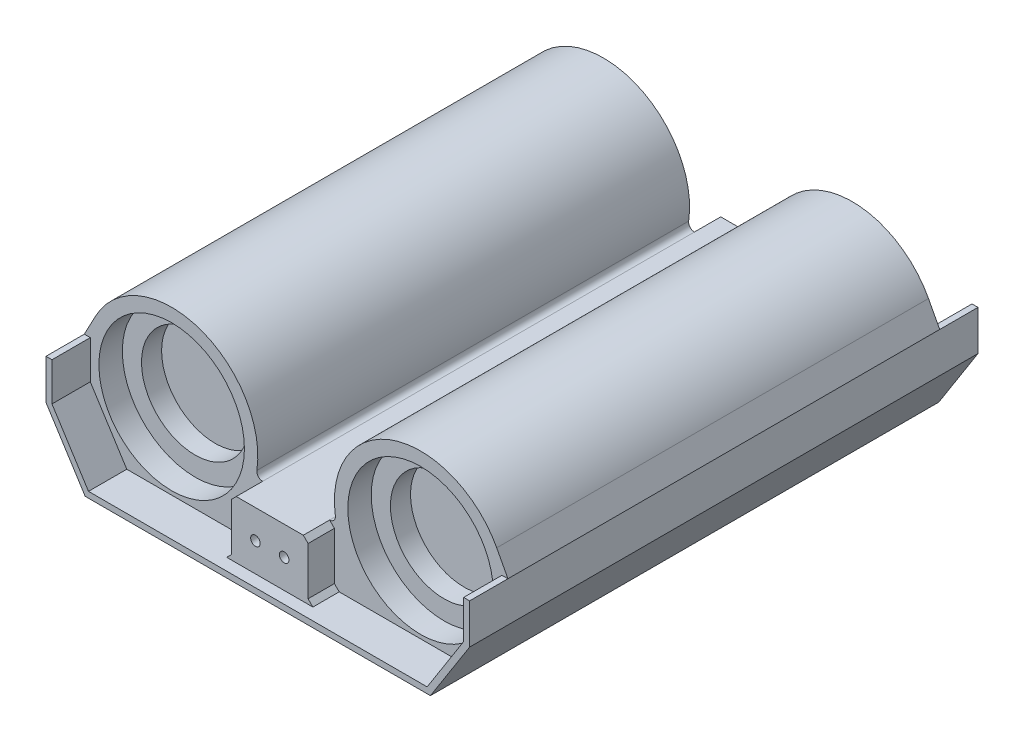
from build123d import *

# Parameters (mm, degrees)
SKETCH3_W                = 40
SKETCH3_H                = 30
SKETCH3_R                = 2.5
BOSS_EXTRUDE2_DEPTH      = 6.25
SKETCH4_W                = 40
SKETCH4_H                = 6.25
BOSS_EXTRUDE3_DEPTH      = 7.5
BOSS_EXTRUDE4_DEPTH      = 20
CHAMFER1_SIZE            = 2.5
SKETCH6_R                = 38
BOSS_EXTRUDE5_DEPTH      = 12.25
SKETCH8_R                = 28
BOSS_EXTRUDE7_DEPTH      = 10.5
SKETCH9_R                = 31.125
BOSS_EXTRUDE8_DEPTH      = 3.125
FILLET1_R                = 4
BOSS_EXTRUDE9_DEPTH      = 90
CHAMFER1_OF_MIRROR1_SIZE = 2.5
FILLET1_OF_MIRROR1_R     = 4
SKETCH12_R               = 2.5
BOSS_EXTRUDE10_DEPTH     = 30
SKETCH14_R               = 2.5
CUT_EXTRUDE1_DEPTH       = 10


with BuildPart() as part:
    # Sketch3 → Boss-Extrude2 (new body)
    with BuildSketch(Plane.XY):
        with Locations((0, -25)):
            Rectangle(SKETCH3_W, SKETCH3_H)
        with Locations((7.5, -25)):
            Circle(SKETCH3_R, mode=Mode.SUBTRACT)
        with Locations((-7.5, -25)):
            Circle(SKETCH3_R, mode=Mode.SUBTRACT)
    boss_extrude2 = extrude(amount=BOSS_EXTRUDE2_DEPTH)

    # Sketch4 → Boss-Extrude3 (add)
    with BuildSketch(Plane.XY.offset(6.25)):
        with Locations((0, -36.875)):
            Rectangle(SKETCH4_W, SKETCH4_H)
    boss_extrude3 = extrude(amount=BOSS_EXTRUDE3_DEPTH)

    # Sketch5 → Boss-Extrude4 (add)
    with BuildSketch(Plane.XY.offset(13.75)):
        Polygon((-20, -40), (-88.428700673, -40), (-107.5, -10), (-107.5, 10), (-110.625, 10), (-110.625, -10.909213368), (-90.145103003, -43.125), (90.145103003, -43.125), (110.625, -10.909213368), (110.625, 10), (107.5, 10), (107.5, -10), (88.428700673, -40), (20, -40), align=None)
    boss_extrude4 = extrude(amount=-BOSS_EXTRUDE4_DEPTH)

    # Chamfer1
    chamfer1_edges = [part.edges().sort_by_distance(p)[0] for p in [
        (-20, -40, 6.875),
        (-20, -10, 3.125),
        (20, -10, 3.125),
        (20, -40, 6.875),
    ]]
    chamfer(chamfer1_edges, length=CHAMFER1_SIZE)

    # Sketch6 → Boss-Extrude5 (add)
    with BuildSketch(Plane.XY.offset(13.75)):
        with BuildLine():
            Line((-110.625, 10), (-104.767593775, 21.060353399))
            ThreePointArc((-104.767593775, 21.060353399), (-50.991609061, 42.764061819), (-20.479289941, -6.550295858))
            ThreePointArc((-20.479289941, -6.550295858), (-19.779069285, -8.956923473), (-17.5, -10))
            Line((-17.5, -10), (17.5, -10))
            ThreePointArc((17.5, -10), (19.779069285, -8.956923473), (20.479289941, -6.550295858))
            ThreePointArc((20.479289941, -6.550295858), (50.991609061, 42.764061819), (104.767593775, 21.060353399))
            Line((104.767593775, 21.060353399), (110.625, 10))
            Line((110.625, 10), (110.625, -10.909213368))
            Line((110.625, -10.909213368), (90.145103003, -43.125))
            Line((90.145103003, -43.125), (-90.145103003, -43.125))
            Line((-90.145103003, -43.125), (-110.625, -10.909213368))
            Line((-110.625, -10.909213368), (-110.625, 10))
        make_face()
        with Locations((-65, 0)):
            Circle(SKETCH6_R, mode=Mode.SUBTRACT)
        with Locations(Location((65, 0, 0), (0, 0, 180))):
            Circle(SKETCH6_R, mode=Mode.SUBTRACT)
    boss_extrude5 = extrude(amount=BOSS_EXTRUDE5_DEPTH)

    # Sketch8 → Boss-Extrude7 (add)
    with BuildSketch(Plane.XY.offset(26)):
        with BuildLine():
            Line((-104.767593775, 21.060353399), (-110.625, 10))
            Line((-110.625, 10), (-110.625, -10.909213368))
            Line((-110.625, -10.909213368), (-90.145103003, -43.125))
            Line((-90.145103003, -43.125), (90.145103003, -43.125))
            Line((90.145103003, -43.125), (110.625, -10.909213368))
            Line((110.625, -10.909213368), (110.625, 10))
            Line((110.625, 10), (104.767593775, 21.060353399))
            ThreePointArc((104.767593775, 21.060353399), (50.991609061, 42.764061819), (20.479289941, -6.550295858))
            ThreePointArc((20.479289941, -6.550295858), (19.779069285, -8.956923473), (17.5, -10))
            Line((17.5, -10), (-17.5, -10))
            ThreePointArc((-17.5, -10), (-19.779069285, -8.956923473), (-20.479289941, -6.550295858))
            ThreePointArc((-20.479289941, -6.550295858), (-50.991609061, 42.764061819), (-104.767593775, 21.060353399))
        make_face()
        with Locations(Location((-65, 0, 0), (0, 0, 180))):
            Circle(SKETCH8_R, mode=Mode.SUBTRACT)
        with Locations(Location((65, 0, 0), (0, 0, 180))):
            Circle(SKETCH8_R, mode=Mode.SUBTRACT)
    boss_extrude7 = extrude(amount=BOSS_EXTRUDE7_DEPTH)

    # Sketch9 → Boss-Extrude8 (add)
    with BuildSketch(Plane.XY.offset(36.5)):
        with Locations(Location((65, 0, 0), (0, 0, 180))):
            Circle(SKETCH9_R)
        with Locations((-65, 0)):
            Circle(SKETCH9_R)
    boss_extrude8 = extrude(amount=BOSS_EXTRUDE8_DEPTH)

    # Fillet1
    # the kernel refuses this fillet: 4 mm, written as the material it adds along each edge
    with BuildSketch(Plane(origin=(-65, 0, 36.5), x_dir=(1, 0, 0), z_dir=(0, -1, 0))) as fillet1_piece_1:
        with BuildLine():
            CenterArc((35.028123749, 4), FILLET1_R, 192.635625093, 77.364374907)
            Line((31.125, 3.125), (31.046937525, 3.1075))
            ThreePointArc((31.046937525, 3.1075), (31.045, 1.5625), (31.045, 0))
            Line((31.045, 0), (31.125, -0.08))
            Line((31.125, -0.08), (35.028123749, -0.08))
            Line((35.028123749, -0.08), (35.028123749, 0))
        make_face()
    revolve(axis=Axis((-65, 0, 36.5), (0, 0, 1)))
    with BuildSketch(Plane(origin=(65, 0, 36.5), x_dir=(-1, 0, 0), z_dir=(0, 1, 0))) as fillet1_piece_2:
        with BuildLine():
            CenterArc((35.028123749, 4), FILLET1_R, 192.635625093, 77.364374907)
            Line((31.125, 3.125), (31.046937525, 3.1075))
            ThreePointArc((31.046937525, 3.1075), (31.045, 1.5625), (31.045, 0))
            Line((31.045, 0), (31.125, -0.08))
            Line((31.125, -0.08), (35.028123749, -0.08))
            Line((35.028123749, -0.08), (35.028123749, 0))
        make_face()
    revolve(axis=Axis((65, 0, 36.5), (0, 0, 1)))

    # Sketch10 → Boss-Extrude9 (add)
    with BuildSketch(Plane.XY.offset(36.5)):
        with BuildLine():
            Line((-104.767593775, 21.060353399), (-110.625, 10))
            Line((-110.625, 10), (-110.625, -10.909213368))
            Line((-110.625, -10.909213368), (-90.145103003, -43.125))
            Line((-90.145103003, -43.125), (-47.5, -43.125))
            Line((-47.5, -43.125), (-47.5, -40))
            Line((-47.5, -40), (-88.428700673, -40))
            Line((-88.428700673, -40), (-107.5, -10))
            Line((-107.5, -10), (-107.5, 9.223599474))
            Line((-107.5, 9.223599474), (-102.005955319, 19.597828858))
            ThreePointArc((-102.005955319, 19.597828858), (-51.964413987, 39.794335304), (-23.571005917, -6.095414201))
            ThreePointArc((-23.571005917, -6.095414201), (-22.144141184, -10.999485568), (-17.5, -13.125))
            Line((-17.5, -13.125), (17.5, -13.125))
            ThreePointArc((17.5, -13.125), (22.144141184, -10.999485568), (23.571005917, -6.095414201))
            ThreePointArc((23.571005917, -6.095414201), (51.964413987, 39.794335304), (102.005955319, 19.597828858))
            Line((102.005955319, 19.597828858), (107.5, 9.223599474))
            Line((107.5, 9.223599474), (107.5, -10))
            Line((107.5, -10), (88.428700673, -40))
            Line((88.428700673, -40), (47.5, -40))
            Line((47.5, -40), (47.5, -43.125))
            Line((47.5, -43.125), (90.145103003, -43.125))
            Line((90.145103003, -43.125), (110.625, -10.909213368))
            Line((110.625, -10.909213368), (110.625, 10))
            Line((110.625, 10), (104.767593775, 21.060353399))
            ThreePointArc((104.767593775, 21.060353399), (50.991609061, 42.764061819), (20.479289941, -6.550295858))
            ThreePointArc((20.479289941, -6.550295858), (19.779069285, -8.956923473), (17.5, -10))
            Line((17.5, -10), (-17.5, -10))
            ThreePointArc((-17.5, -10), (-19.779069285, -8.956923473), (-20.479289941, -6.550295858))
            ThreePointArc((-20.479289941, -6.550295858), (-50.991609061, 42.764061819), (-104.767593775, 21.060353399))
        make_face()
    boss_extrude9 = extrude(amount=BOSS_EXTRUDE9_DEPTH)

    # Mirror1: Boss-Extrude2, Boss-Extrude3, Boss-Extrude4, Boss-Extrude5, Boss-Extrude7, Boss-Extrude8, Boss-Extrude9 across plane
    add(boss_extrude2.mirror(Plane(origin=(-65, 0, 126.5), x_dir=(1, 0, 0), z_dir=(0, 0, 1))))
    add(boss_extrude3.mirror(Plane(origin=(-65, 0, 126.5), x_dir=(1, 0, 0), z_dir=(0, 0, 1))))
    add(boss_extrude4.mirror(Plane(origin=(-65, 0, 126.5), x_dir=(1, 0, 0), z_dir=(0, 0, 1))))
    add(boss_extrude5.mirror(Plane(origin=(-65, 0, 126.5), x_dir=(1, 0, 0), z_dir=(0, 0, 1))))
    add(boss_extrude7.mirror(Plane(origin=(-65, 0, 126.5), x_dir=(1, 0, 0), z_dir=(0, 0, 1))))
    add(boss_extrude8.mirror(Plane(origin=(-65, 0, 126.5), x_dir=(1, 0, 0), z_dir=(0, 0, 1))))
    add(boss_extrude9.mirror(Plane(origin=(-65, 0, 126.5), x_dir=(1, 0, 0), z_dir=(0, 0, 1))))

    # Chamfer1 of Mirror1
    chamfer1_of_mirror1_edges = [part.edges().sort_by_distance(p)[0] for p in [
        (-20, -40, 246.125),
        (-20, -10, 249.875),
        (20, -10, 249.875),
        (20, -40, 246.125),
    ]]
    chamfer(chamfer1_of_mirror1_edges, length=CHAMFER1_OF_MIRROR1_SIZE)

    # Fillet1 of Mirror1
    # the kernel refuses this fillet: 4 mm, written as the material it adds along each edge
    with BuildSketch(Plane(origin=(-65, 0, 216.5), x_dir=(1, 0, 0), z_dir=(0, -1, 0))) as fillet1_of_mirror1_piece_1:
        with BuildLine():
            CenterArc((35.028123749, -4), FILLET1_OF_MIRROR1_R, 90, 77.364374907)
            Line((31.125, -3.125), (31.046937525, -3.1075))
            ThreePointArc((31.046937525, -3.1075), (31.045, -1.5625), (31.045, 0))
            Line((31.045, 0), (31.125, 0.08))
            Line((31.125, 0.08), (35.028123749, 0.08))
            Line((35.028123749, 0.08), (35.028123749, 0))
        make_face()
    revolve(axis=Axis((-65, 0, 216.5), (0, 0, 1)))
    with BuildSketch(Plane(origin=(65, 0, 216.5), x_dir=(-1, 0, 0), z_dir=(0, 1, 0))) as fillet1_of_mirror1_piece_2:
        with BuildLine():
            CenterArc((35.028123749, -4), FILLET1_OF_MIRROR1_R, 90, 77.364374907)
            Line((31.125, -3.125), (31.046937525, -3.1075))
            ThreePointArc((31.046937525, -3.1075), (31.045, -1.5625), (31.045, 0))
            Line((31.045, 0), (31.125, 0.08))
            Line((31.125, 0.08), (35.028123749, 0.08))
            Line((35.028123749, 0.08), (35.028123749, 0))
        make_face()
    revolve(axis=Axis((65, 0, 216.5), (0, 0, 1)))

    # Sketch12 → Boss-Extrude10 (add)
    with BuildSketch(Plane.XY.offset(253)):
        Polygon((-20, -12.5), (-20, -37.5), (-22.5, -40), (22.5, -40), (20, -37.5), (20, -12.5), (17.5, -10), (-17.5, -10), align=None)
        with Locations((7.5, -25)):
            Circle(SKETCH12_R, mode=Mode.SUBTRACT)
        with Locations((-7.5, -25)):
            Circle(SKETCH12_R, mode=Mode.SUBTRACT)
    boss_extrude10 = extrude(amount=-BOSS_EXTRUDE10_DEPTH)

    # Mirror2: Boss-Extrude10 across plane
    add(boss_extrude10.mirror(Plane(origin=(0, 0, 126.5), x_dir=(1, 0, 0), z_dir=(0, 0, -1))))

    # Sketch14 → Cut-Extrude1 (cut)
    with BuildSketch(Plane.XZ.offset(43.125)):
        with Locations((10, 237.75)):
            Circle(SKETCH14_R)
        with Locations(Location((-10, 237.75, 0), (0, 0, 180))):
            Circle(SKETCH14_R)
        with Locations((-10, 15.25)):
            Circle(SKETCH14_R)
        with Locations(Location((10, 15.25, 0), (0, 0, 180))):
            Circle(SKETCH14_R)
    extrude(amount=-CUT_EXTRUDE1_DEPTH, mode=Mode.SUBTRACT)


solid = part.part
